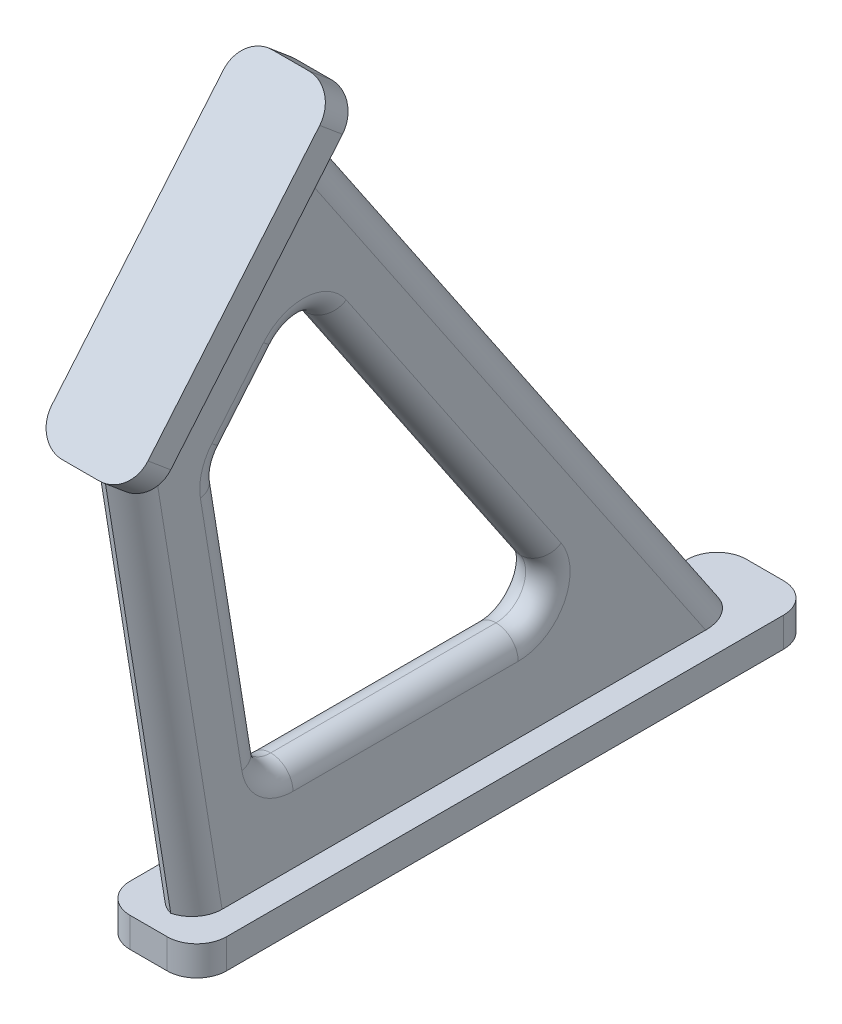
from build123d import *

# Parameters (mm, degrees)
BOSS_EXTRUDE1_DEPTH     = 1.5
SKETCH2_W               = 6.5
SKETCH2_H               = 41.6
BOSS_EXTRUDE2_DEPTH     = 2
SKETCH3_W               = 6.5
SKETCH3_H               = 22.029549655
BOSS_EXTRUDE3_DEPTH     = 2
CUT_EXTRUDE1_DEPTH      = 66.428669726
CUT_EXTRUDE1_DEPTH_BACK = 66.428669726
FILLET1_R               = 2
FILLET2_R               = 1.5


# Some blends are built 0.0001 mm under size
with BuildPart() as part:
    # Sketch1 → Boss-Extrude1 (new, symmetric)
    with BuildSketch(Plane(origin=(0, 0, 0), x_dir=(0, 0, -1), z_dir=(1, 0, 0))):
        Polygon((-43.305040632, 32.259635184), (-38.1, 0), (0, 0), (-31.3944757, 46.45409373), align=None)
    extrude(amount=BOSS_EXTRUDE1_DEPTH, both=True)

    # Sketch2 → Boss-Extrude2 (add)
    with BuildSketch(Plane.XZ):
        with Locations((0, 19.05)):
            Rectangle(SKETCH2_W, SKETCH2_H)
    extrude(amount=-BOSS_EXTRUDE2_DEPTH)

    # Sketch3 → Boss-Extrude3 (add)
    with BuildSketch(Plane(origin=(0, 34.65247404, 41.29721043), x_dir=(1, 0, 0), z_dir=(0, 0.6427876096865434, 0.7660444431189747))):
        with Locations((0, 6.141145543)):
            Rectangle(SKETCH3_W, SKETCH3_H)
    extrude(amount=-BOSS_EXTRUDE3_DEPTH)

    # Sketch4 → Cut-Extrude1 (cut, two sides: drawn at the far end of the back side and taken through both)
    with BuildSketch(Plane(origin=(1.5, 0, 0), x_dir=(0, 0, -1), z_dir=(1, 0, 0)).offset(-CUT_EXTRUDE1_DEPTH_BACK)):
        Polygon((-36.523365649, 27.895930093), (-33.313189095, 8), (-12.648239091, 8), (-30.746767143, 34.780212116), align=None)
    extrude(amount=CUT_EXTRUDE1_DEPTH + CUT_EXTRUDE1_DEPTH_BACK, mode=Mode.SUBTRACT)

    # Fillet1
    # the kernel refuses this fillet: 2 mm, written as the material it adds along each edge
    with BuildSketch(Plane(origin=(1.5, 34.780212116, 30.746767143), x_dir=(0, -0.8285345686504685, -0.5599379149076996), z_dir=(-1, 0, 0))) as fillet1_piece_1:
        with BuildLine():
            CenterArc((FILLET1_R * 1.32580458231, FILLET1_R), FILLET1_R, 164.051504254, 105.948495746)
            Line((FILLET1_R * 0.364295499179, FILLET1_R * 1.27477314835), (0, 0))
            Line((0, 0), (FILLET1_R * 1.32580458231, 0))
        make_face()
    extrude(amount=3)
    with BuildSketch(Plane(origin=(-1.5, 8, 12.648239091), x_dir=(0, 0, 1), z_dir=(1, 0, 0))) as fillet1_piece_2:
        with BuildLine():
            CenterArc((FILLET1_R * 1.88276744741, -FILLET1_R), FILLET1_R, 90, 124.051504254)
            Line((FILLET1_R * 1.05423287876, -FILLET1_R * 1.55993791491), (0, 0))
            Line((0, 0), (FILLET1_R * 1.88276744741, 0))
        make_face()
    extrude(amount=3)
    with BuildSketch(Plane(origin=(1.5, 27.895930093, 36.523365649), x_dir=(0, 0.7660444431189765, -0.6427876096865413), z_dir=(-1, 0, 0))) as fillet1_piece_3:
        with BuildLine():
            CenterArc((FILLET1_R * 0.457472572927, FILLET1_R), FILLET1_R, 220.834409573, 49.165590427)
            Line((-FILLET1_R * 0.299129927729, FILLET1_R * 0.346124892658), (0, 0))
            Line((0, 0), (FILLET1_R * 0.457472572927, 0))
        make_face()
    extrude(amount=3)
    with BuildSketch(Plane(origin=(-1.5, 8, 33.313189095), x_dir=(0, 0, -1), z_dir=(1, 0, 0))) as fillet1_piece_4:
        with BuildLine():
            CenterArc((FILLET1_R * 0.851584618699, FILLET1_R), FILLET1_R, 189.165590427, 80.834409573)
            Line((-FILLET1_R * 0.135647486653, FILLET1_R * 0.840711676004), (0, 0))
            Line((0, 0), (FILLET1_R * 0.851584618699, 0))
        make_face()
    extrude(amount=3)
    # the kernel refuses this fillet: 2 mm, written as the material it takes off along each edge
    with BuildSketch(Plane(origin=(-1.5, 34.586150343, 43.680420138), x_dir=(0, 0.1592883239956265, -0.9872321053524669), z_dir=(0, -0.987232105352467, -0.15928832399562654))) as fillet1_2_piece_1_section:
        with BuildLine():
            CenterArc((FILLET1_R, FILLET1_R), FILLET1_R, 180, 90)
            Line((0, FILLET1_R), (0, 0))
            Line((0, 0), (FILLET1_R, 0))
        make_face()
    fillet1_2_piece_1 = extrude(amount=38.007587746, mode=Mode.PRIVATE)
    fillet1_2_piece_1 = split(fillet1_2_piece_1, bisect_by=Plane(origin=(-1.056244864, 22.976919754, 48.483349146), z_dir=(0, -0.6427876096865434, -0.7660444431189747)), keep=Keep.TOP, mode=Mode.PRIVATE)
    fillet1_2_piece_1 = split(fillet1_2_piece_1, bisect_by=Plane(origin=(-1.056244864, 2, 40.232595457), z_dir=(0, 1, 0)), keep=Keep.TOP, mode=Mode.PRIVATE)
    add(fillet1_2_piece_1, mode=Mode.SUBTRACT)
    with BuildSketch(Plane(origin=(-1.5, -2.142672843, -1.448055168), x_dir=(1, 0, 0), z_dir=(0, 0.8285345686504687, 0.5599379149076993))) as fillet1_2_piece_2_section:
        with BuildLine():
            CenterArc((FILLET1_R, -FILLET1_R), FILLET1_R, 90, 90)
            Line((0, -FILLET1_R), (0, 0))
            Line((0, 0), (FILLET1_R, 0))
        make_face()
    fillet1_2_piece_2 = extrude(amount=61.573815732, mode=Mode.PRIVATE)
    fillet1_2_piece_2 = split(fillet1_2_piece_2, bisect_by=Plane(origin=(-1.05170861, 38.993973381, 35.043445356), z_dir=(0, -0.6427876096865434, -0.7660444431189747)), keep=Keep.TOP, mode=Mode.PRIVATE)
    fillet1_2_piece_2 = split(fillet1_2_piece_2, bisect_by=Plane(origin=(-1.05170861, 2, 16.20714214), z_dir=(0, 1, 0)), keep=Keep.TOP, mode=Mode.PRIVATE)
    add(fillet1_2_piece_2, mode=Mode.SUBTRACT)
    with BuildSketch(Plane(origin=(1.5, -2.142672843, -1.448055168), x_dir=(0, -0.5599379149076993, 0.8285345686504687), z_dir=(0, 0.8285345686504687, 0.5599379149076993))) as fillet1_2_piece_3_section:
        with BuildLine():
            CenterArc((FILLET1_R, -FILLET1_R), FILLET1_R, 90, 90)
            Line((0, -FILLET1_R), (0, 0))
            Line((0, 0), (FILLET1_R, 0))
        make_face()
    fillet1_2_piece_3 = extrude(amount=61.573815732, mode=Mode.PRIVATE)
    fillet1_2_piece_3 = split(fillet1_2_piece_3, bisect_by=Plane(origin=(1.05170861, 38.993973381, 35.043445356), z_dir=(0, -0.6427876096865434, -0.7660444431189747)), keep=Keep.TOP, mode=Mode.PRIVATE)
    fillet1_2_piece_3 = split(fillet1_2_piece_3, bisect_by=Plane(origin=(1.05170861, 2, 16.20714214), z_dir=(0, 1, 0)), keep=Keep.TOP, mode=Mode.PRIVATE)
    add(fillet1_2_piece_3, mode=Mode.SUBTRACT)
    with BuildSketch(Plane(origin=(1.5, 34.586150343, 43.680420138), x_dir=(0, 0.1592883239956265, -0.9872321053524669), z_dir=(0, -0.987232105352467, -0.15928832399562654))) as fillet1_2_piece_4_section:
        with BuildLine():
            CenterArc((FILLET1_R, -FILLET1_R), FILLET1_R, 90, 90)
            Line((0, -FILLET1_R), (0, 0))
            Line((0, 0), (FILLET1_R, 0))
        make_face()
    fillet1_2_piece_4 = extrude(amount=38.007587746, mode=Mode.PRIVATE)
    fillet1_2_piece_4 = split(fillet1_2_piece_4, bisect_by=Plane(origin=(1.056244864, 22.976919754, 48.483349146), z_dir=(0, -0.6427876096865434, -0.7660444431189747)), keep=Keep.TOP, mode=Mode.PRIVATE)
    fillet1_2_piece_4 = split(fillet1_2_piece_4, bisect_by=Plane(origin=(1.056244864, 2, 40.232595457), z_dir=(0, 1, 0)), keep=Keep.TOP, mode=Mode.PRIVATE)
    add(fillet1_2_piece_4, mode=Mode.SUBTRACT)
    with BuildSketch(Plane(origin=(-3.25, 51.008609554, 34.099819599), x_dir=(0, -0.7660444431189747, 0.6427876096865432), z_dir=(0, -0.6427876096865434, -0.7660444431189747)), Plane(origin=(-3.25, -5, 39.85), x_dir=(0, 0, -1), z_dir=(0, 1, 0)), Plane(origin=(3.25, -5, 39.85), x_dir=(-1, 0, 0), z_dir=(0, 1, 0))) as fillet1_2_piece_5:
        with BuildLine():
            CenterArc((FILLET1_R, -FILLET1_R), FILLET1_R, 90, 90)
            Line((0, -FILLET1_R), (0, 0))
            Line((0, 0), (FILLET1_R, 0))
        make_face()
    extrude(amount=12, mode=Mode.SUBTRACT)
    with BuildSketch(Plane(origin=(-3.25, 34.132995457, 48.260141164), x_dir=(0, 0.7660444431189747, -0.6427876096865434), z_dir=(0, -0.6427876096865434, -0.7660444431189747)), Plane(origin=(3.25, 34.132995457, 48.260141164), x_dir=(-1, 0, 0), z_dir=(0, -0.6427876096865434, -0.7660444431189747))) as fillet1_2_piece_6:
        with BuildLine():
            CenterArc((FILLET1_R, FILLET1_R), FILLET1_R, 180, 90)
            Line((0, FILLET1_R), (0, 0))
            Line((0, 0), (FILLET1_R, 0))
        make_face()
    extrude(amount=7, mode=Mode.SUBTRACT)
    with BuildSketch(Plane(origin=(3.25, 51.008609554, 34.099819599), x_dir=(0, -0.7660444431189747, 0.6427876096865432), z_dir=(0, -0.6427876096865434, -0.7660444431189747)), Plane(origin=(-3.25, -5, -1.75), x_dir=(0, 0, 1), z_dir=(0, 1, 0)), Plane(origin=(3.25, -5, -1.75), x_dir=(-1, 0, 0), z_dir=(0, 1, 0))) as fillet1_2_piece_7:
        with BuildLine():
            CenterArc((FILLET1_R, FILLET1_R), FILLET1_R, 180, 90)
            Line((0, FILLET1_R), (0, 0))
            Line((0, 0), (FILLET1_R, 0))
        make_face()
    extrude(amount=12, mode=Mode.SUBTRACT)

    # Fillet2
    fillet2_edges = [part.edges().sort_by_distance(p)[0] for p in [
        (1.5, 9.061850667, 14.647456961),
        (1.5, 21.851569045, 22.009367742),
        (1.5, 33.460692344, 30.815325558),
        (1.5, 30.672890194, 34.193219453),
        (1.5, 27.842934726, 36.331192599),
        (1.5, 18.337045111, 34.981054819),
        (1.5, 8.477312689, 32.906716951),
        (-1.5, 9.061850667, 14.647456961),
        (-1.5, 21.851569045, 22.009367742),
        (-1.5, 33.460692344, 30.815325558),
        (-1.5, 30.672890194, 34.193219453),
        (-1.5, 27.842934726, 36.331192599),
        (-1.5, 18.337045111, 34.981054819),
        (-1.5, 8.477312689, 32.906716951),
        (1.5, 8, 24.011896921),
        (-1.5, 8, 24.011896921),
    ]]
    fillet(fillet2_edges, radius=FILLET2_R - 0.0001)  # a hair under: the kernel refuses the full size


solid = part.part
